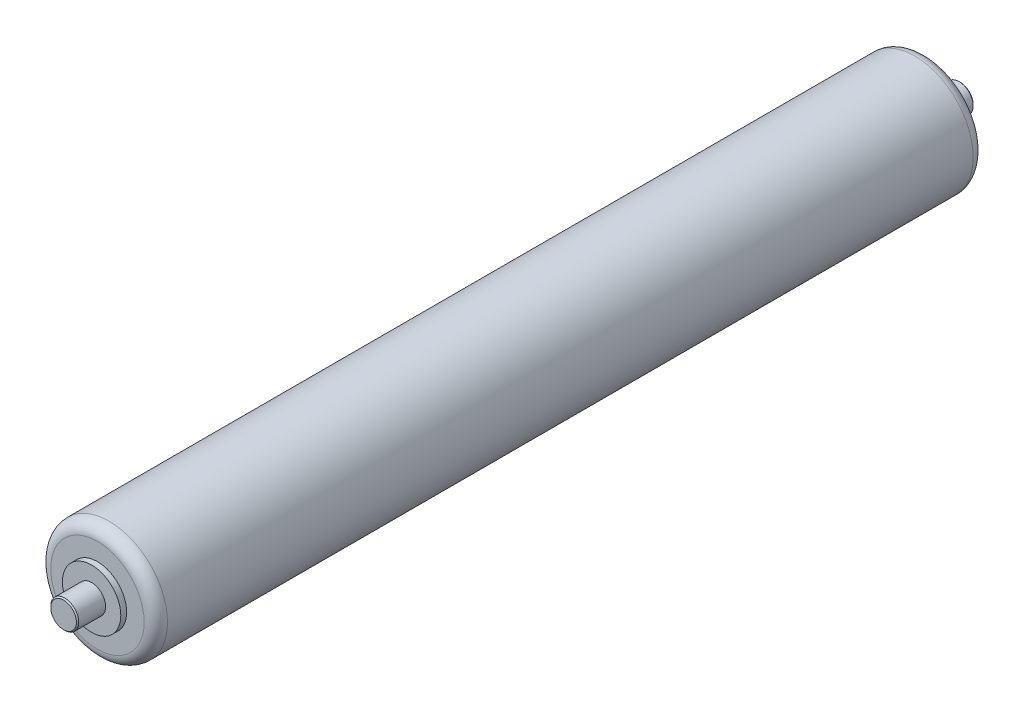
from build123d import *

# Parameters (mm, degrees)
FILLET1_R = 5


with BuildPart() as part:
    # Sketch1 → Revolve1 (revolve)
    with BuildSketch(Plane(origin=(0, 0, 0), x_dir=(1, 0, 0), z_dir=(0, 1, 0))):
        Polygon((5.5, 14.5), (0, 14.5), (0, -369.5), (5.5, -369.5), (6, -369), (6, -357.5), (12.5, -357.5), (12.5, -355), (25, -355), (25, 0), (12.5, 0), (12.5, 2.5), (6, 2.5), (6, 14), align=None)
    revolve(axis=Axis((0, 0, -14.5), (0, 0, 1)))

    # Fillet1
    fillet1_edges = [part.edges().sort_by_distance(p)[0] for p in [
        (-25, 0, 355),
        (-25, 0, 0),
    ]]
    fillet(fillet1_edges, radius=FILLET1_R)


solid = part.part
